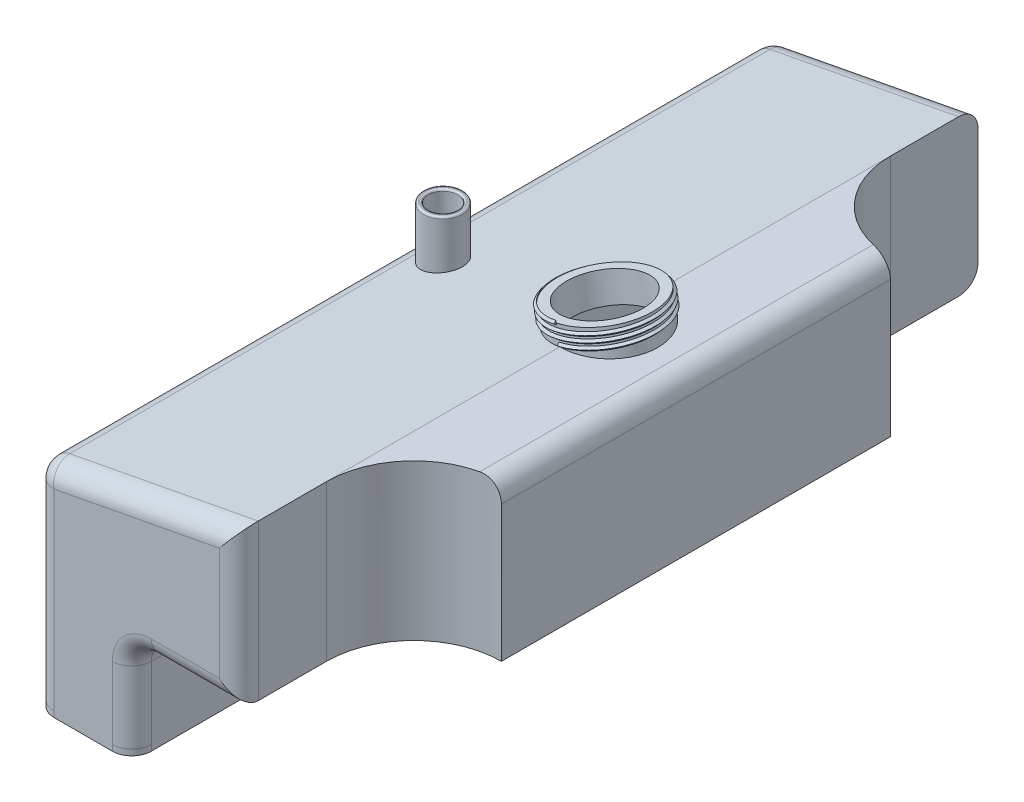
from build123d import *

# Parameters (mm, degrees)
BOSS_EXTRUDE4_DEPTH      = 80
SKETCH2_W                = 50
SKETCH2_H                = 380
BOSS_EXTRUDE5_DEPTH      = 50
CUT_EXTRUDE2_DEPTH       = 417.29316593
FILLET1_R                = 10
FILLET2_R                = 10
SHELL1_T                 = -5
SKETCH5_W                = 50
SKETCH5_H                = 3
BOSS_EXTRUDE6_DEPTH      = 375
FILLET3_R                = 10
BOSS_EXTRUDE7_DEPTH      = 10
BOSS_EXTRUDE7_DEPTH_BACK = 5
SKETCH6_R                = 25
SKETCH6_R_2              = 20
SWEEP1_PITCH             = 3
CUT_EXTRUDE3_REACH       = 275.12
SKETCH9_R                = 20
BOSS_EXTRUDE8_DEPTH      = 10
BOSS_EXTRUDE8_DEPTH_BACK = 120
SKETCH10_R               = 10
SKETCH10_R_2             = 7.5
FILLET4_R                = 1
SKETCH11_R               = 7.5
CUT_EXTRUDE4_DEPTH       = 120
CUT_EXTRUDE7_DEPTH       = 12
CUT_EXTRUDE7_DEPTH_BACK  = 12


with BuildPart() as part:
    # Sketch1 → Boss-Extrude4 (new body)
    with BuildSketch(Plane(origin=(0, 0, 0), x_dir=(1, 0, 0), z_dir=(0, 1, 0))):
        with BuildLine():
            Line((0, 100), (0, -100))
            ThreePointArc((0, -100), (-31.819805153, -113.180194847), (-45, -145))
            Line((-45, -145), (-45, -190))
            Line((-45, -190), (-150, -190))
            Line((-150, -190), (-150, -145))
            Line((-150, -145), (-150, 145))
            Line((-150, 145), (-150, 190))
            Line((-150, 190), (-45, 190))
            Line((-45, 190), (-45, 145))
            ThreePointArc((-45, 145), (-31.819805153, 113.180194847), (0, 100))
        make_face()
    extrude(amount=BOSS_EXTRUDE4_DEPTH)

    # Sketch2 → Boss-Extrude5 (add)
    with BuildSketch(Plane.XZ):
        with Locations((-125, 0)):
            Rectangle(SKETCH2_W, SKETCH2_H)
    extrude(amount=BOSS_EXTRUDE5_DEPTH)

    # Sketch4 → Cut-Extrude2 (cut, through all)
    with BuildSketch(Plane.XY.offset(190)):
        Polygon((-150, 60), (-45, 80), (-150, 80), align=None)
    extrude(amount=-CUT_EXTRUDE2_DEPTH, mode=Mode.SUBTRACT)

    # Fillet1
    fillet1_edges = [part.edges().sort_by_distance(p)[0] for p in [
        (-72.5, 0, -190),
        (-45, 40, 190),
        (-72.5, 0, 190),
        (-100, 0, 0),
        (-100, -25, -190),
        (-100, -25, 190),
        (-150, 5, 190),
        (-150, 5, -190),
        (-97.5, 70, -190),
        (-150, 60, 0),
        (-97.5, 70, 190),
    ]]
    fillet(fillet1_edges, radius=FILLET1_R)

    # Fillet2
    fillet2_edges = [part.edges().sort_by_distance(p)[0] for p in [
        (0, 80, 0),
    ]]
    fillet(fillet2_edges, radius=FILLET2_R)

    # Shell1
    shell1_openings = [part.faces().sort_by_distance(p)[0] for p in [
        (-125, -50, 0),
    ]]
    offset(amount=SHELL1_T, openings=shell1_openings)

    # Sketch5 → Boss-Extrude6 (add)
    with BuildSketch(Plane.XY.offset(-185)):
        with Locations((-125, -48.5)):
            Rectangle(SKETCH5_W, SKETCH5_H)
    extrude(amount=BOSS_EXTRUDE6_DEPTH)

    # Fillet3
    # the kernel refuses this fillet: 10 mm, written as the material it takes off along each edge
    with BuildSketch(Plane(origin=(-150, -34.5, -185), x_dir=(0, 0, 1), z_dir=(0, -1, 0))) as fillet3_piece_1:
        with BuildLine():
            CenterArc((5, -10), FILLET3_R, 90, 30)
            Line((0, -1.339745962), (-0.1, -1.166540881))
            ThreePointArc((-0.1, -1.166540881), (-0.2, -0.669872981), (-0.2, 0))
            Line((-0.2, 0), (0, 0.2))
            Line((0, 0.2), (5, 0.2))
            Line((5, 0.2), (5, 0))
        make_face()
    extrude(amount=28, mode=Mode.SUBTRACT)
    with BuildSketch(Plane(origin=(-100, -62.5, -185), x_dir=(-1, 0, 0), z_dir=(0, 1, 0))) as fillet3_piece_2:
        with BuildLine():
            CenterArc((10, 5), FILLET3_R, 180, 30)
            Line((0, 5), (-0.2, 5))
            Line((-0.2, 5), (-0.2, 0))
            Line((-0.2, 0), (0, -0.2))
            ThreePointArc((0, -0.2), (0.669872981, -0.2), (1.166540881, -0.1))
            Line((1.166540881, -0.1), (1.339745962, 0))
        make_face()
    extrude(amount=28, mode=Mode.SUBTRACT)
    with BuildSketch(Plane(origin=(-100, -75, 190), x_dir=(-1, 0, 0), z_dir=(0, 1, 0))) as fillet3_piece_3:
        with BuildLine():
            CenterArc((FILLET3_R, -FILLET3_R), FILLET3_R, 90, 90)
            Line((0, -FILLET3_R), (-FILLET3_R * 0.02, -FILLET3_R))
            Line((-FILLET3_R * 0.02, -FILLET3_R), (-FILLET3_R * 0.02, FILLET3_R * 0.02))
            Line((-FILLET3_R * 0.02, FILLET3_R * 0.02), (FILLET3_R, FILLET3_R * 0.02))
            Line((FILLET3_R, FILLET3_R * 0.02), (FILLET3_R, 0))
        make_face()
    extrude(amount=53, mode=Mode.SUBTRACT)
    with BuildSketch(Plane(origin=(-150, -22, 190), x_dir=(0, 0, -1), z_dir=(0, -1, 0))) as fillet3_piece_4:
        with BuildLine():
            CenterArc((FILLET3_R, FILLET3_R), FILLET3_R, 180, 90)
            Line((0, FILLET3_R), (-FILLET3_R * 0.02, FILLET3_R))
            Line((-FILLET3_R * 0.02, FILLET3_R), (-FILLET3_R * 0.02, -FILLET3_R * 0.02))
            Line((-FILLET3_R * 0.02, -FILLET3_R * 0.02), (FILLET3_R, -FILLET3_R * 0.02))
            Line((FILLET3_R, -FILLET3_R * 0.02), (FILLET3_R, 0))
        make_face()
    extrude(amount=53, mode=Mode.SUBTRACT)

    # Sketch6 → Boss-Extrude7 (add, two sides: drawn at the far end of the back side and taken through both)
    with BuildSketch(Plane(origin=(-16.280087527, 85.470459519, 0), x_dir=(0.9823385664224747, 0.18711210788999527, 0), z_dir=(-0.18711210788999527, 0.9823385664224747, 0)).offset(-BOSS_EXTRUDE7_DEPTH_BACK)):
        with Locations(Location((-29.236266858, 0, 0), (0, 0, 180))):
            Circle(SKETCH6_R)
        with Locations(Location((-29.236266858, 0, 0), (0, 0, 180))):
            Circle(SKETCH6_R_2, mode=Mode.SUBTRACT)
    extrude(amount=BOSS_EXTRUDE7_DEPTH + BOSS_EXTRUDE7_DEPTH_BACK)

    # Sweep1: arcs per turn and ends read off the stored shape
    # Sweep1: the profile of Sketch8 profile screwed along a right-hand helix through 3 turns, 10 arcs to a turn; built about Z, then put on its axis
    sweep1_z = Axis((0, 0, 0), (0, 0, 1))
    sweep1_corners = [(24.9997, 0, -1.00024938), (24.9997, 0, 1.00024938), (26.202981652, 0, 0)]
    with BuildLine(mode=Mode.PRIVATE) as sweep1_profile:
        Line(sweep1_corners[0], sweep1_corners[1])
        Line(sweep1_corners[1], sweep1_corners[2])
        Line(sweep1_corners[2], sweep1_corners[0])
    sweep1_cap = Face(sweep1_profile.wire())
    sweep1_turn_angles = [0, 18, 36, 54, 72, 90, 108, 126, 144, 162, 180, 198, 216, 234, 252, 270, 288, 306, 324, 342, 360]
    sweep1_turn_weights = [1, 0.9510565162951535, 1, 0.9510565162951535, 1, 0.9510565162951535, 1, 0.9510565162951535, 1, 0.9510565162951535, 1, 0.9510565162951535, 1, 0.9510565162951535, 1, 0.9510565162951535, 1, 0.9510565162951535, 1, 0.9510565162951535, 1]
    sweep1_turn_rails = [Edge.make_bspline([Vector(p[0], p[1], 0).rotate(sweep1_z, sweep1_turn_angles[k]) / sweep1_turn_weights[k] + Vector(0, 0, p[2] + SWEEP1_PITCH * sweep1_turn_angles[k] / 360) for k in range(21)], [0, 0, 0, 1, 1, 2, 2, 3, 3, 4, 4, 5, 5, 6, 6, 7, 7, 8, 8, 9, 9, 10, 10, 10], 2, sweep1_turn_weights) for p in sweep1_corners]
    sweep1_turn_sides = [Face.make_surface_from_curves(sweep1_turn_rails[p[0]], sweep1_turn_rails[p[1]]) for p in [(0, 1), (1, 2), (2, 0)]]
    sweep1 = Plane(origin=(-46.871121079, 89.823385664, 0), x_dir=(0, 0, 1), z_dir=(0.1871121078899953, -0.9823385664224747, 0)) * Solid(Shell([*[p.moved(Location((0, 0, SWEEP1_PITCH * i))) for i in range(3) for p in sweep1_turn_sides], sweep1_cap, sweep1_cap.rotate(sweep1_z, 1080).moved(Location((0, 0, SWEEP1_PITCH * 1080 / 360)))]))
    add(sweep1)

    # Sketch9 → Cut-Extrude3 (cut, up to next)
    with BuildSketch(Plane(origin=(-18.151208606, 95.293845183, 0), x_dir=(0.9823385664224747, 0.1871121078899953, 0), z_dir=(-0.1871121078899953, 0.9823385664224747, 0)), mode=Mode.PRIVATE) as cut_extrude3_sk1:
        with Locations(Location((-29.236266858, 0, 0), (0, 0, 180))):
            Circle(SKETCH9_R)
    cut_extrude3_tool1 = extrude(cut_extrude3_sk1.sketch, amount=-CUT_EXTRUDE3_REACH, mode=Mode.PRIVATE) & part.part
    add(cut_extrude3_tool1.solids().sort_by_distance((-46.871121, 89.823386, 0))[0], mode=Mode.SUBTRACT)

    # Sketch11 → Cut-Extrude4 (cut)
    with BuildSketch(Plane(origin=(0, 90, 0), x_dir=(1, 0, 0), z_dir=(0, 1, 0))):
        with Locations(Location((-130, 0, 0), (0, 0, 270))):
            Circle(SKETCH11_R)
    extrude(amount=-CUT_EXTRUDE4_DEPTH, mode=Mode.SUBTRACT)


with BuildPart() as body_2:
    # Sketch10 → Boss-Extrude8 (new, two sides: drawn at the far end of the back side and taken through both)
    with BuildSketch(Plane(origin=(0, 80, 0), x_dir=(1, 0, 0), z_dir=(0, 1, 0)).offset(-BOSS_EXTRUDE8_DEPTH_BACK)):
        with Locations(Location((-130, 0, 0), (0, 0, 270))):
            Circle(SKETCH10_R)
        with Locations(Location((-130, 0, 0), (0, 0, 270))):
            Circle(SKETCH10_R_2, mode=Mode.SUBTRACT)
    extrude(amount=BOSS_EXTRUDE8_DEPTH + BOSS_EXTRUDE8_DEPTH_BACK)

    # Fillet4
    fillet4_edges = [body_2.edges().sort_by_distance(p)[0] for p in [
        (-130, 90, -10),
        (-130, 90, -7.5),
    ]]
    fillet(fillet4_edges, radius=FILLET4_R)

    # Sketch12 → Cut-Extrude7 (cut, two sides: drawn at the far end of the back side and taken through both)
    with BuildSketch(Plane.XY.offset(-CUT_EXTRUDE7_DEPTH_BACK)):
        Polygon((-119.513658556, -23.124001798), (-119.513658556, -40.509386217), (-140.796522102, -40.509386217), align=None)
    extrude(amount=CUT_EXTRUDE7_DEPTH + CUT_EXTRUDE7_DEPTH_BACK, mode=Mode.SUBTRACT)


solid = Compound([part.part, body_2.part])
